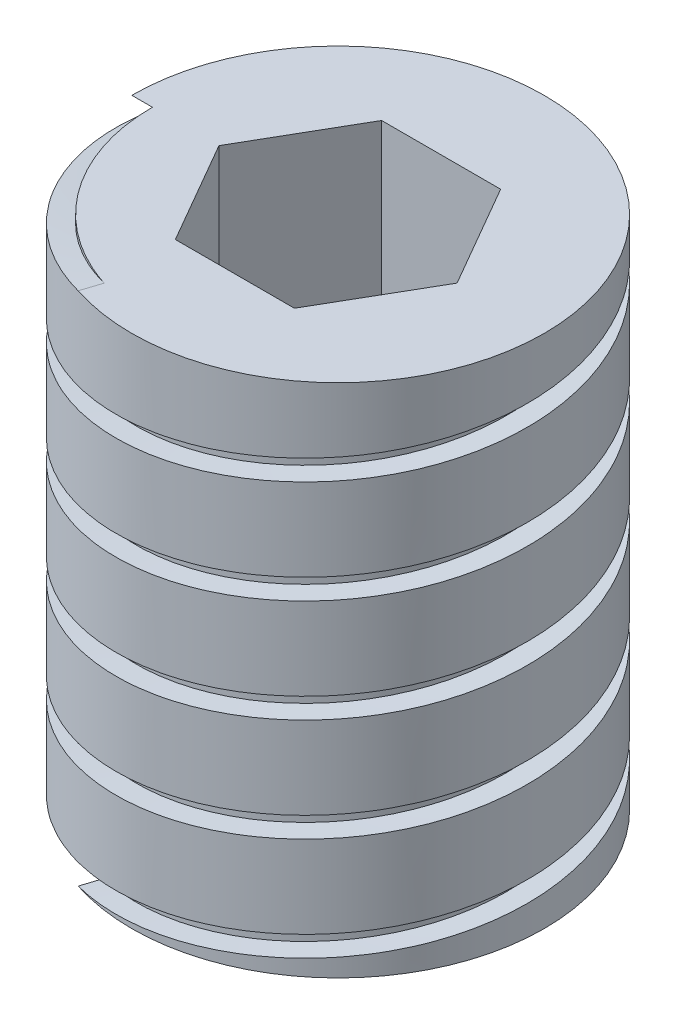
from build123d import *

# Parameters (mm, degrees)
SKETCH1_R           = 40
BOSS_EXTRUDE1_DEPTH = 100
CUT_EXTRUDE1_DEPTH  = 100
CUT_SWEEP2_PITCH    = 20


with BuildPart() as part:
    # Sketch1 → Boss-Extrude1 (new body)
    with BuildSketch(Plane(origin=(0, 0, 0), x_dir=(1, 0, 0), z_dir=(0, 1, 0))):
        with Locations(Location((0, 0, 0), (0, 0, 270))):
            Circle(SKETCH1_R)
    extrude(amount=-BOSS_EXTRUDE1_DEPTH)

    # Sketch2 → Cut-Extrude1 (cut)
    with BuildSketch(Plane(origin=(0, 0, 0), x_dir=(1, 0, 0), z_dir=(0, 1, 0))):
        Polygon((23.094010768, 0), (11.547005384, 20), (-11.547005384, 20), (-23.094010768, 0), (-11.547005384, -20), (11.547005384, -20), align=None)
    extrude(amount=-CUT_EXTRUDE1_DEPTH, mode=Mode.SUBTRACT)

    # Cut-Sweep2: arcs per turn and ends read off the stored shape
    # Cut-Sweep2: the profile of Sketch5 profile screwed along a right-hand helix through 6.5 turns, 20 arcs to a turn; built about Z, then put on its axis
    cut_sweep2_z = Axis((0, 0, 0), (0, 0, 1))
    cut_sweep2_corners = [(40.0003, 0, -20), (36, 0, -20), (36, 0, -16), (40.0003, 0, -16)]
    with BuildLine(mode=Mode.PRIVATE) as cut_sweep2_profile:
        Line(cut_sweep2_corners[0], cut_sweep2_corners[1])
        Line(cut_sweep2_corners[1], cut_sweep2_corners[2])
        Line(cut_sweep2_corners[2], cut_sweep2_corners[3])
        Line(cut_sweep2_corners[3], cut_sweep2_corners[0])
    cut_sweep2_cap = Face(cut_sweep2_profile.wire())
    cut_sweep2_turn_angles = [0, 9, 18, 27, 36, 45, 54, 63, 72, 81, 90, 99, 108, 117, 126, 135, 144, 153, 162, 171, 180, 189, 198, 207, 216, 225, 234, 243, 252, 261, 270, 279, 288, 297, 306, 315, 324, 333, 342, 351, 360]
    cut_sweep2_turn_weights = [1, 0.9876883405951378, 1, 0.9876883405951378, 1, 0.9876883405951378, 1, 0.9876883405951378, 1, 0.9876883405951378, 1, 0.9876883405951378, 1, 0.9876883405951378, 1, 0.9876883405951378, 1, 0.9876883405951378, 1, 0.9876883405951378, 1, 0.9876883405951378, 1, 0.9876883405951378, 1, 0.9876883405951378, 1, 0.9876883405951378, 1, 0.9876883405951378, 1, 0.9876883405951378, 1, 0.9876883405951378, 1, 0.9876883405951378, 1, 0.9876883405951378, 1, 0.9876883405951378, 1]
    cut_sweep2_turn_rails = [Edge.make_bspline([Vector(p[0], p[1], 0).rotate(cut_sweep2_z, cut_sweep2_turn_angles[k]) / cut_sweep2_turn_weights[k] + Vector(0, 0, p[2] + CUT_SWEEP2_PITCH * cut_sweep2_turn_angles[k] / 360) for k in range(41)], [0, 0, 0, 1, 1, 2, 2, 3, 3, 4, 4, 5, 5, 6, 6, 7, 7, 8, 8, 9, 9, 10, 10, 11, 11, 12, 12, 13, 13, 14, 14, 15, 15, 16, 16, 17, 17, 18, 18, 19, 19, 20, 20, 20], 2, cut_sweep2_turn_weights) for p in cut_sweep2_corners]
    cut_sweep2_turn_sides = [Face.make_surface_from_curves(cut_sweep2_turn_rails[p[0]], cut_sweep2_turn_rails[p[1]]) for p in [(0, 1), (1, 2), (2, 3), (3, 0)]]
    cut_sweep2_last_angles = [2160, 2169, 2178, 2187, 2196, 2205, 2214, 2223, 2232, 2241, 2250, 2259, 2268, 2277, 2286, 2295, 2304, 2313, 2322, 2331, 2340]
    cut_sweep2_last_weights = [1, 0.9876883405951378, 1, 0.9876883405951378, 1, 0.9876883405951378, 1, 0.9876883405951378, 1, 0.9876883405951378, 1, 0.9876883405951378, 1, 0.9876883405951378, 1, 0.9876883405951378, 1, 0.9876883405951378, 1, 0.9876883405951378, 1]
    cut_sweep2_last_rails = [Edge.make_bspline([Vector(p[0], p[1], 0).rotate(cut_sweep2_z, cut_sweep2_last_angles[k]) / cut_sweep2_last_weights[k] + Vector(0, 0, p[2] + CUT_SWEEP2_PITCH * cut_sweep2_last_angles[k] / 360) for k in range(21)], [0, 0, 0, 1, 1, 2, 2, 3, 3, 4, 4, 5, 5, 6, 6, 7, 7, 8, 8, 9, 9, 10, 10, 10], 2, cut_sweep2_last_weights) for p in cut_sweep2_corners]
    cut_sweep2_last_sides = [Face.make_surface_from_curves(cut_sweep2_last_rails[p[0]], cut_sweep2_last_rails[p[1]]) for p in [(0, 1), (1, 2), (2, 3), (3, 0)]]
    cut_sweep2 = Plane(origin=(0, 0, 0), x_dir=(-1, 0, 0), z_dir=(0, -1, 0)) * Solid(Shell([*[p.moved(Location((0, 0, CUT_SWEEP2_PITCH * i))) for i in range(6) for p in cut_sweep2_turn_sides], *cut_sweep2_last_sides, cut_sweep2_cap, cut_sweep2_cap.rotate(cut_sweep2_z, 2340).moved(Location((0, 0, CUT_SWEEP2_PITCH * 2340 / 360)))]))
    add(cut_sweep2, mode=Mode.SUBTRACT)


solid = part.part
